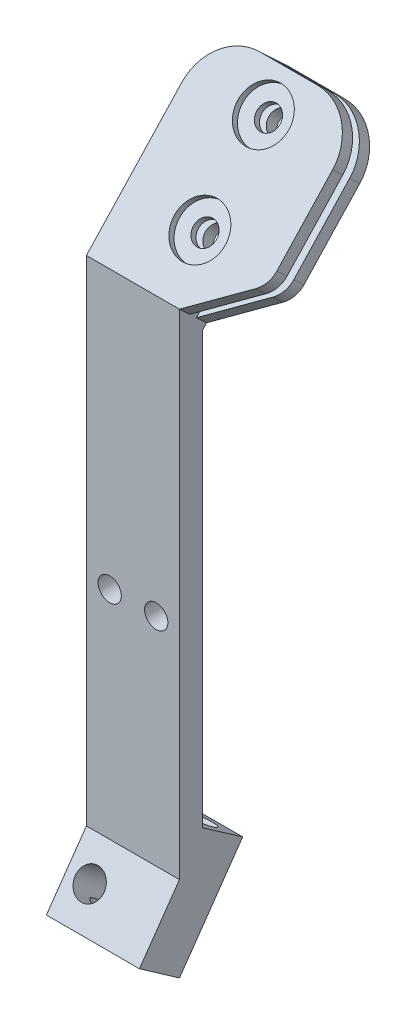
from build123d import *

# Parameters (mm, degrees)
BOSS_EXTRUDE1_DEPTH     = 20
CUT_EXTRUDE1_DEPTH      = 173.601162969
CUT_EXTRUDE1_DEPTH_BACK = 173.601162969
BOSS_EXTRUDE2_DEPTH     = 20
BOSS_EXTRUDE4_DEPTH     = 10
SKETCH7_R               = 3.1
CUT_EXTRUDE3_DEPTH      = 161.534558428
BOSS_EXTRUDE5_DEPTH     = 10
SKETCH9_R               = 3.1
CUT_EXTRUDE4_DEPTH      = 147.401949114
CUT_EXTRUDE5_DEPTH      = 175.168303714
CUT_EXTRUDE6_DEPTH      = 10
SKETCH12_R              = 2.5
CUT_EXTRUDE7_DEPTH      = 162.946023748
FILLET3_R               = 5
FILLET4_R               = 10
SKETCH15_R              = 2.5
CUT_EXTRUDE10_DEPTH     = 5
BOSS_EXTRUDE6_DEPTH     = 3
BOSS_EXTRUDE7_START     = -5
BOSS_EXTRUDE7_DEPTH     = 3
CUT_EXTRUDE11_REACH     = 164.653
SKETCH16_4_R            = 2.5
CHAMFER1_SIZE           = 8.3
FILLET5_R               = 5
SKETCH17_R              = 5.5
CUT_EXTRUDE12_DEPTH     = 1.5
FILLET6_R               = 5


# Read off the part's stored shape, not the designer's step: Save Bodies1
# Some blends are built 0.0001 mm under size
with BuildPart() as part:
    # Sketch1 → Boss-Extrude1 (new body)
    with BuildSketch(Plane(origin=(0, 0, 0), x_dir=(0, 0, -1), z_dir=(1, 0, 0))):
        Polygon((0, 0), (-27.279934402, -29.254148065), (-27.279934402, -169.254148065), (-22.279934402, -169.254148065), (-22.279934402, -31.223700443), (3.656768508, -3.4099918), align=None)
    extrude(amount=BOSS_EXTRUDE1_DEPTH)

    # Sketch2 → Cut-Extrude1 (cut, two sides: drawn at the far end of the back side and taken through both)
    with BuildSketch(Plane(origin=(20, 0, 0), x_dir=(0, 0, -1), z_dir=(1, 0, 0)).offset(-CUT_EXTRUDE1_DEPTH_BACK)):
        Polygon((2.194061105, -2.04599508), (-23.742641806, -29.859703723), (-22.279934402, -31.223700443), (3.656768508, -3.4099918), align=None)
    extrude(amount=CUT_EXTRUDE1_DEPTH + CUT_EXTRUDE1_DEPTH_BACK, mode=Mode.SUBTRACT)

    # Sketch3 → Boss-Extrude2 (add)
    with BuildSketch(Plane(origin=(20, 0, 0), x_dir=(0, 0, -1), z_dir=(1, 0, 0))):
        Polygon((3.656768508, -3.4099918), (-22.279934402, -31.223700443), (-20.085873298, -33.269695523), (5.850829613, -5.45598688), align=None)
        Polygon((-22.279934402, -35.622538), (-20.085873298, -33.269695523), (-22.279934402, -31.223700443), align=None)
    extrude(amount=-BOSS_EXTRUDE2_DEPTH)

    # Sketch6 → Boss-Extrude4 (add)
    with BuildSketch(Plane.ZY):
        Polygon((27.279934402, -135.441491542), (27.279934402, -153.753110374), (35.883580948, -147.728772207), align=None)
        Polygon((22.279934402, -138.942529233), (13.676287857, -144.9668674), (22.279934402, -157.254148065), align=None)
    extrude(amount=-BOSS_EXTRUDE4_DEPTH)

    # Sketch7 → Cut-Extrude3 (cut, through all)
    with BuildSketch(Plane(origin=(0, -41.266885928, -58.935220882), x_dir=(-1, 0, 0), z_dir=(0, -0.5735764363510402, -0.8191520442889961))):
        with Locations(Location((-5, -134.094302237, 0), (0, 0, 90))):
            Circle(SKETCH7_R)
    extrude(amount=-CUT_EXTRUDE3_DEPTH, mode=Mode.SUBTRACT)

    # Sketch8 → Boss-Extrude5 (add)
    with BuildSketch(Plane(origin=(20, 0, 0), x_dir=(0, 0, -1), z_dir=(1, 0, 0))):
        Polygon((-35.883580948, -147.728772207), (-31.581757675, -150.74094129), (-27.279934402, -144.597300958), (-27.279934402, -135.441491542), align=None)
        Polygon((-17.969117113, -131.300075805), (-22.279934402, -137.456560924), (-22.279934402, -146.61237034), (-13.695141582, -134.273766824), align=None)
        Polygon((-27.279934402, -144.597300958), (-31.581757675, -150.74094129), (-27.279934402, -153.753110374), align=None)
        Polygon((-22.279934402, -128.300751509), (-22.279934402, -137.456560924), (-17.969117113, -131.300075805), align=None)
    extrude(amount=-BOSS_EXTRUDE5_DEPTH)

    # Sketch9 → Cut-Extrude4 (cut, through all)
    with BuildSketch(Plane(origin=(0, -115.987262137, 81.215155285), x_dir=(-1, 0, 0), z_dir=(0, -0.8191520442889961, 0.5735764363510402))):
        with Locations(Location((-15, 60.591190556, 0), (0, 0, 90))):
            Circle(SKETCH9_R)
    extrude(amount=-CUT_EXTRUDE4_DEPTH, mode=Mode.SUBTRACT)

    # Sketch10 → Cut-Extrude5 (cut, through all)
    with BuildSketch(Plane.ZY):
        Polygon((22.279934402, -157.254148065), (27.279934402, -153.753110374), (27.279934402, -169.254148065), (22.279934402, -169.254148065), align=None)
    extrude(amount=-CUT_EXTRUDE5_DEPTH, mode=Mode.SUBTRACT)

    # Sketch11 → Cut-Extrude6 (cut)
    with BuildSketch(Plane(origin=(20, 0, 0), x_dir=(0, 0, -1), z_dir=(1, 0, 0))):
        Polygon((-22.279934402, -157.254148065), (-22.279934402, -146.61237034), (-27.279934403, -153.753110374), align=None)
    extrude(amount=-CUT_EXTRUDE6_DEPTH, mode=Mode.SUBTRACT)

    # Sketch12 → Cut-Extrude7 (cut, through all)
    with BuildSketch(Plane.XY.offset(27.279934402)):
        with Locations((5, -88.896520317)):
            Circle(SKETCH12_R)
        with Locations((15, -88.896520317)):
            Circle(SKETCH12_R)
    extrude(amount=-CUT_EXTRUDE7_DEPTH, mode=Mode.SUBTRACT)

    # Fillet3
    # the kernel refuses this fillet: 5 mm, written as the material it takes off along each edge
    with BuildSketch(Plane(origin=(-12.5, -157.254148065, 22.279934402), x_dir=(0, 0.5735764363510394, 0.8191520442889965), z_dir=(1, 0, 0))) as fillet3_piece_1:
        with BuildLine():
            CenterArc((FILLET3_R, -FILLET3_R), FILLET3_R, 90, 90)
            Line((0, -FILLET3_R), (0, 0))
            Line((0, 0), (FILLET3_R, 0))
        make_face()
    extrude(amount=35, mode=Mode.SUBTRACT)

    # Fillet4
    fillet4_edges = [part.edges().sort_by_distance(p)[0] for p in [
        (0, -4.43298934, -4.753799061),
        (20, -4.43298934, -4.753799061),
        (0, -1.02299754, -1.097030552),
        (20, -1.02299754, -1.097030552),
    ]]
    fillet(fillet4_edges, radius=FILLET4_R - 0.0001)  # a hair under: the kernel refuses the full size

    # Sketch15 → Cut-Extrude10 (cut)
    with BuildSketch(Plane(origin=(0, -115.987262137, 81.215155285), x_dir=(1, 0, 0), z_dir=(0, -0.8191520442889961, 0.5735764363510402))):
        with Locations(Location((5, -61.143127027, 0), (0, 0, 270))):
            Circle(SKETCH15_R)
    extrude(amount=-CUT_EXTRUDE10_DEPTH, mode=Mode.SUBTRACT)

    # Sketch16 → Boss-Extrude6 (add)
    with BuildSketch(Plane(origin=(0, 0, 0), x_dir=(1, 0, 0), z_dir=(0, 0.6819983600624997, 0.7313537016191695))):
        with BuildLine():
            Line((20, -10), (20, -40))
            Line((20, -40), (32.454585159, -30))
            Line((32.454585159, -30), (32.454585159, -10))
            ThreePointArc((32.454585159, -10), (29.52565297, -2.928932188), (22.454585159, 0))
            Line((22.454585159, 0), (10, 0))
            ThreePointArc((10, 0), (17.071067812, -2.928932188), (20, -10))
        make_face()
    extrude(amount=-BOSS_EXTRUDE6_DEPTH)

    # Sketch16<3> → Boss-Extrude7 (add)
    with BuildSketch(Plane(origin=(0, 0, 0), x_dir=(1, 0, 0), z_dir=(0, 0.6819983600624997, 0.7313537016191695)).offset(BOSS_EXTRUDE7_START)):
        with BuildLine():
            Line((20, -10), (20, -40))
            Line((20, -40), (32.454585159, -30))
            Line((32.454585159, -30), (32.454585159, -10))
            ThreePointArc((32.454585159, -10), (29.52565297, -2.928932188), (22.454585159, 0))
            Line((22.454585159, 0), (10, 0))
            ThreePointArc((10, 0), (17.071067812, -2.928932188), (20, -10))
        make_face()
    extrude(amount=-BOSS_EXTRUDE7_DEPTH)

    # Cut-Extrude11: up to this face of the body (flat: up to its plane)
    cut_extrude11_end = Plane(part.part.faces().sort_by_distance((15.482284505, -20.226716455, 7.923098549))[0])
    # Sketch16<4> → Cut-Extrude11 (cut, up to the picked face)
    with BuildSketch(Plane(origin=(0, 0, 0), x_dir=(1, 0, 0), z_dir=(0, 0.6819983600624997, 0.7313537016191695)), mode=Mode.PRIVATE) as cut_extrude11_sk1:
        with BuildLine():
            ThreePointArc((13.727292579, -8.030447622), (16.227292579, -10.530447622), (18.727292579, -8.030447622))
            Line((18.727292579, -8.030447622), (13.727292579, -8.030447622))
        make_face()
    cut_extrude11_tool1 = split(extrude(cut_extrude11_sk1.sketch, amount=-CUT_EXTRUDE11_REACH, mode=Mode.PRIVATE), bisect_by=cut_extrude11_end, keep=Keep.BOTH, mode=Mode.PRIVATE)
    # Sketch16<4> → Cut-Extrude11 (cut, up to the picked face)
    with BuildSketch(Plane(origin=(0, 0, 0), x_dir=(1, 0, 0), z_dir=(0, 0.6819983600624997, 0.7313537016191695)), mode=Mode.PRIVATE) as cut_extrude11_sk2:
        with BuildLine():
            Line((13.727292579, -8.030447622), (18.727292579, -8.030447622))
            ThreePointArc((18.727292579, -8.030447622), (16.227292579, -5.530447622), (13.727292579, -8.030447622))
        make_face()
    cut_extrude11_tool2 = split(extrude(cut_extrude11_sk2.sketch, amount=-CUT_EXTRUDE11_REACH, mode=Mode.PRIVATE), bisect_by=cut_extrude11_end, keep=Keep.BOTH, mode=Mode.PRIVATE)
    # Sketch16<4> → Cut-Extrude11 (cut, up to the picked face)
    with BuildSketch(Plane(origin=(0, 0, 0), x_dir=(1, 0, 0), z_dir=(0, 0.6819983600624997, 0.7313537016191695)), mode=Mode.PRIVATE) as cut_extrude11_sk3:
        with BuildLine():
            ThreePointArc((13.727292579, -8.030447622), (16.227292579, -10.530447622), (18.727292579, -8.030447622))
            Line((18.727292579, -8.030447622), (13.727292579, -8.030447622))
        make_face()
    cut_extrude11_tool3 = split(extrude(cut_extrude11_sk3.sketch, amount=-CUT_EXTRUDE11_REACH, mode=Mode.PRIVATE), bisect_by=cut_extrude11_end, keep=Keep.BOTH, mode=Mode.PRIVATE)
    # Sketch16<4> → Cut-Extrude11 (cut, up to the picked face)
    with BuildSketch(Plane(origin=(0, 0, 0), x_dir=(1, 0, 0), z_dir=(0, 0.6819983600624997, 0.7313537016191695)), mode=Mode.PRIVATE) as cut_extrude11_sk4:
        with BuildLine():
            Line((13.727292579, -8.030447622), (18.727292579, -8.030447622))
            ThreePointArc((18.727292579, -8.030447622), (16.227292579, -5.530447622), (13.727292579, -8.030447622))
        make_face()
    cut_extrude11_tool4 = split(extrude(cut_extrude11_sk4.sketch, amount=-CUT_EXTRUDE11_REACH, mode=Mode.PRIVATE), bisect_by=cut_extrude11_end, keep=Keep.BOTH, mode=Mode.PRIVATE)
    # Sketch16<4> → Cut-Extrude11 (cut, up to the picked face)
    with BuildSketch(Plane(origin=(0, 0, 0), x_dir=(1, 0, 0), z_dir=(0, 0.6819983600624997, 0.7313537016191695)), mode=Mode.PRIVATE) as cut_extrude11_sk5:
        with Locations(Location((16.227292579, -28.030447622, 0), (0, 0, 270))):
            Circle(SKETCH16_4_R)
    cut_extrude11_tool5 = split(extrude(cut_extrude11_sk5.sketch, amount=-CUT_EXTRUDE11_REACH, mode=Mode.PRIVATE), bisect_by=cut_extrude11_end, keep=Keep.BOTH, mode=Mode.PRIVATE)
    add(cut_extrude11_tool1.solids().sort_by(Axis((16.227293, -6.649088, 6.200375), (0, -0.6819983600624997, -0.7313537016191695)))[0], mode=Mode.SUBTRACT)
    add(cut_extrude11_tool2.solids().sort_by(Axis((16.227293, -5.097107, 4.753129), (0, -0.6819983600624997, -0.7313537016191695)))[0], mode=Mode.SUBTRACT)
    add(cut_extrude11_tool3.solids().sort_by(Axis((16.227293, -6.649088, 6.200375), (0, -0.6819983600624997, -0.7313537016191695)))[0], mode=Mode.SUBTRACT)
    add(cut_extrude11_tool4.solids().sort_by(Axis((16.227293, -5.097107, 4.753129), (0, -0.6819983600624997, -0.7313537016191695)))[0], mode=Mode.SUBTRACT)
    add(cut_extrude11_tool5.solids().sort_by(Axis((16.227293, -20.500172, 19.116719), (0, -0.6819983600624997, -0.7313537016191695)))[0], mode=Mode.SUBTRACT)

    # Chamfer1
    chamfer1_edges = [part.edges().sort_by_distance(p)[0] for p in [
        (10, -140.198799419, 20.485794641),
        (10, -133.621640371, 22.279934402),
    ]]
    chamfer(chamfer1_edges, length=CHAMFER1_SIZE)

    # Fillet5
    # the kernel refuses this fillet: 5 mm, written as the material it adds along each edge
    with BuildSketch(Plane(origin=(-1.165308952, -140.434114663, 25.145243354), x_dir=(-0.24426096127254496, -0.7383550160762786, -0.6286242542514651), z_dir=(0.6635786184004234, 0.34543716418991527, -0.6635786184004234))) as fillet5_piece_1_section:
        with BuildLine():
            CenterArc((FILLET5_R * 0.34543716419, FILLET5_R), FILLET5_R, 231.886370385, 38.113629615)
            Line((-FILLET5_R * 0.271785890905, FILLET5_R * 0.213211781824), (0, 0))
            Line((0, 0), (FILLET5_R * 0.34543716419, 0))
        make_face()
    fillet5_piece_1 = extrude(amount=21.143866778, mode=Mode.PRIVATE)
    fillet5_piece_1 = split(fillet5_piece_1, bisect_by=Plane(origin=(-1.165308952, -143.792687167, 20.318091976), z_dir=(0, 0.5711279895091977, 0.8208610233158727)), keep=Keep.TOP, mode=Mode.PRIVATE)
    fillet5_piece_1 = split(fillet5_piece_1, bisect_by=Plane(origin=(-1.165308952, -130.915194321, 18.522292961), z_dir=(0, -0.8208610233158725, 0.5711279895091982)), keep=Keep.TOP, mode=Mode.PRIVATE)
    fillet5_piece_1 = split(fillet5_piece_1, bisect_by=Plane(origin=(-1.165308952, -138.086990978, 23.501769657), z_dir=(0, 0.8191520442889962, -0.5735764363510399)), keep=Keep.TOP, mode=Mode.PRIVATE)
    add(fillet5_piece_1)

    # Sketch17 → Cut-Extrude12 (cut)
    with BuildSketch(Plane(origin=(0, 0, 0), x_dir=(1, 0, 0), z_dir=(0, 0.6819983600624997, 0.7313537016191695))):
        with Locations(Location((16.227292579, -28.030447622, 0), (0, 0, 270))):
            Circle(SKETCH17_R)
        with Locations(Location((16.227292579, -8.030447622, 0), (0, 0, 270))):
            Circle(SKETCH17_R)
    extrude(amount=-CUT_EXTRUDE12_DEPTH, mode=Mode.SUBTRACT)

    # Fillet6
    fillet6_edges = [part.edges().sort_by_distance(p)[0] for p in [
        (32.454585159, -22.963608589, 19.362920249),
        (32.454585159, -26.373600389, 15.706151741),
    ]]
    fillet(fillet6_edges, radius=FILLET6_R)


with BuildPart() as body_2:
    # Mirror1: mirrored copy
    add(part.part.mirror(Plane(origin=(30, 0, 0), x_dir=(0, 0, 1), z_dir=(1, 0, 0))))


solid = part.part
